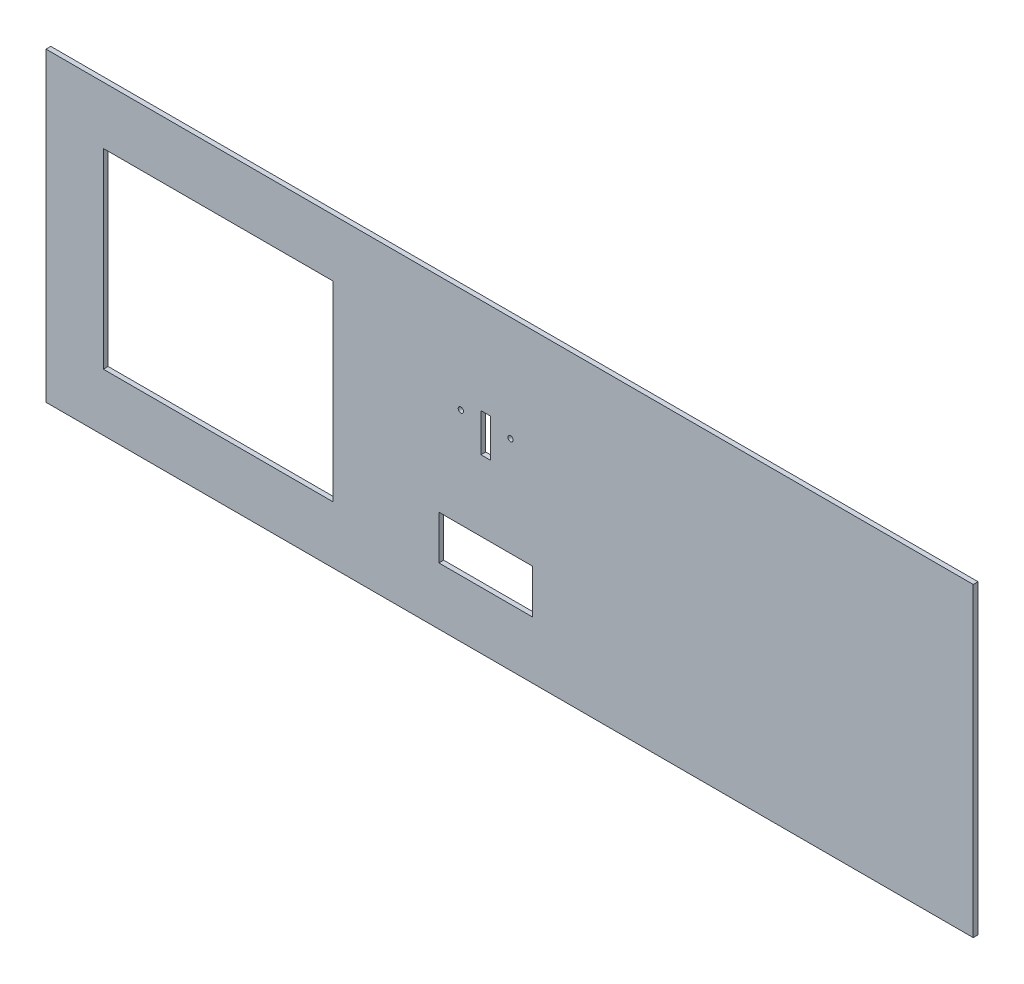
from build123d import *

# Parameters (mm, degrees)
SKETCH1_W           = 615.95
SKETCH1_H           = 203.2
BOSS_EXTRUDE1_DEPTH = 3.175
SKETCH2_W           = 152.4
SKETCH2_H           = 127
CUT_EXTRUDE1_DEPTH  = 325.316575663
SKETCH3_W           = 6.35
SKETCH3_H           = 25.4
CUT_EXTRUDE2_DEPTH  = 325.316575663
SKETCH4_R           = 1.75
CUT_EXTRUDE3_DEPTH  = 325.316575663
SKETCH5_W           = 62.23
SKETCH5_H           = 29.21
CUT_EXTRUDE4_DEPTH  = 325.316575663


with BuildPart() as part:
    # Sketch1 → Boss-Extrude1 (new body)
    with BuildSketch(Plane.XY):
        Rectangle(SKETCH1_W, SKETCH1_H)
    extrude(amount=BOSS_EXTRUDE1_DEPTH)

    # Sketch2 → Cut-Extrude1 (cut, through all)
    with BuildSketch(Plane.XY.offset(3.175)):
        with Locations((-193.675, 0)):
            Rectangle(SKETCH2_W, SKETCH2_H)
    extrude(amount=-CUT_EXTRUDE1_DEPTH, mode=Mode.SUBTRACT)

    # Sketch3 → Cut-Extrude2 (cut, through all)
    with BuildSketch(Plane.XY.offset(3.175)):
        with Locations((-15.875, 25.4)):
            Rectangle(SKETCH3_W, SKETCH3_H)
    extrude(amount=-CUT_EXTRUDE2_DEPTH, mode=Mode.SUBTRACT)

    # Sketch4 → Cut-Extrude3 (cut, through all)
    with BuildSketch(Plane.XY.offset(3.175)):
        with Locations((0.635, 31.75)):
            Circle(SKETCH4_R)
        with Locations((-32.385, 31.75)):
            Circle(SKETCH4_R)
    extrude(amount=-CUT_EXTRUDE3_DEPTH, mode=Mode.SUBTRACT)

    # Sketch5 → Cut-Extrude4 (cut, through all)
    with BuildSketch(Plane.XY.offset(3.175)):
        with Locations((-15.875, -48.895)):
            Rectangle(SKETCH5_W, SKETCH5_H)
    extrude(amount=-CUT_EXTRUDE4_DEPTH, mode=Mode.SUBTRACT)


solid = part.part
